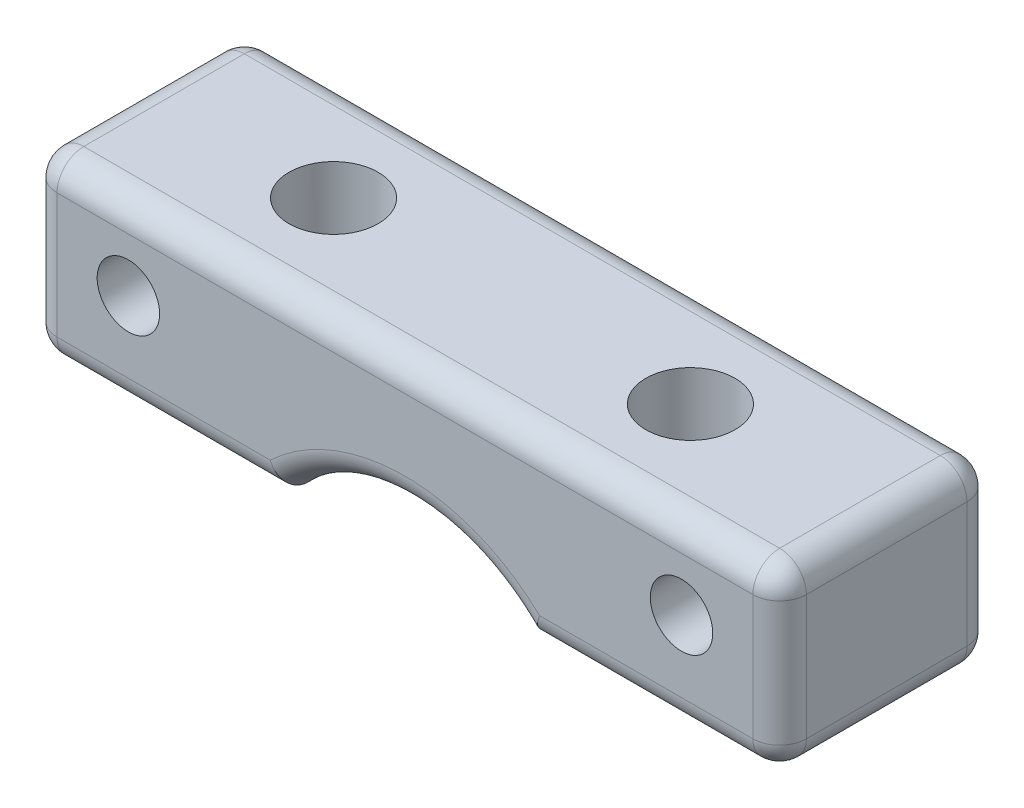
from build123d import *

# Parameters (mm, degrees)
SKETCH1_W        = 42
SKETCH1_H        = 12
SKETCH1_R        = 2.5
MAIN_BOSS_DEPTH  = 10
SKETCH2_R        = 1.75
SKETCH2_R_2      = 9.5
SIDE_HOLES_DEPTH = 27.172504657
FILLET2_R        = 1.5
CHAMFER2_SIZE    = 3


with BuildPart() as part:
    # Sketch1 → main boss (new body)
    with BuildSketch(Plane(origin=(0, 0, 0), x_dir=(1, 0, 0), z_dir=(0, 1, 0))):
        Rectangle(SKETCH1_W, SKETCH1_H)
        with Locations(Location((-10, 0, 0), (0, 0, 270))):
            Circle(SKETCH1_R, mode=Mode.SUBTRACT)
        with Locations(Location((10, 0, 0), (0, 0, 90))):
            Circle(SKETCH1_R, mode=Mode.SUBTRACT)
    extrude(amount=MAIN_BOSS_DEPTH)

    # Sketch2 → side holes (cut, through all)
    with BuildSketch(Plane.XY.offset(6)):
        with Locations((-15.5, 5.5)):
            Circle(SKETCH2_R)
        with Locations(Location((15.5, 5.5, 0), (0, 0, 180))):
            Circle(SKETCH2_R)
        with Locations((0, -6.5)):
            Circle(SKETCH2_R_2)
    extrude(amount=-SIDE_HOLES_DEPTH, mode=Mode.SUBTRACT)

    # Fillet2
    fillet2_edges = [part.edges().sort_by_distance(p)[0] for p in [
        (21, 10, 0),
        (0, 10, -6),
        (-13.964101615, 0, -6),
        (13.964101615, 0, 6),
        (0, 3, -6),
        (0, 3, 6),
        (-21, 10, 0),
        (13.964101615, 0, -6),
        (21, 0, 0),
        (-13.964101615, 0, 6),
        (-21, 0, 0),
        (-21, 5, -6),
        (21, 5, -6),
        (21, 5, 6),
        (-21, 5, 6),
        (0, 10, 6),
    ]]
    fillet(fillet2_edges, radius=FILLET2_R)

    # Chamfer2
    # the kernel refuses this chamfer: 3 mm, written as the material it takes off along each edge
    with BuildSketch(Plane(origin=(-10, 0, 0), x_dir=(0, 0, 1), z_dir=(-1, 0, 0))) as chamfer2_piece_1:
        Polygon((2.5 + CHAMFER2_SIZE, 0), (2.5, CHAMFER2_SIZE), (2.5, 0), align=None)
    revolve(axis=Axis((-10, 0, 0), (0, 1, 0)), mode=Mode.SUBTRACT)
    with BuildSketch(Plane(origin=(10, 0, 0), x_dir=(0, 0, -1), z_dir=(1, 0, 0))) as chamfer2_piece_2:
        Polygon((2.5 + CHAMFER2_SIZE, 0), (2.5, CHAMFER2_SIZE), (2.5, 0), align=None)
    revolve(axis=Axis((10, 0, 0), (0, 1, 0)), mode=Mode.SUBTRACT)


solid = part.part
